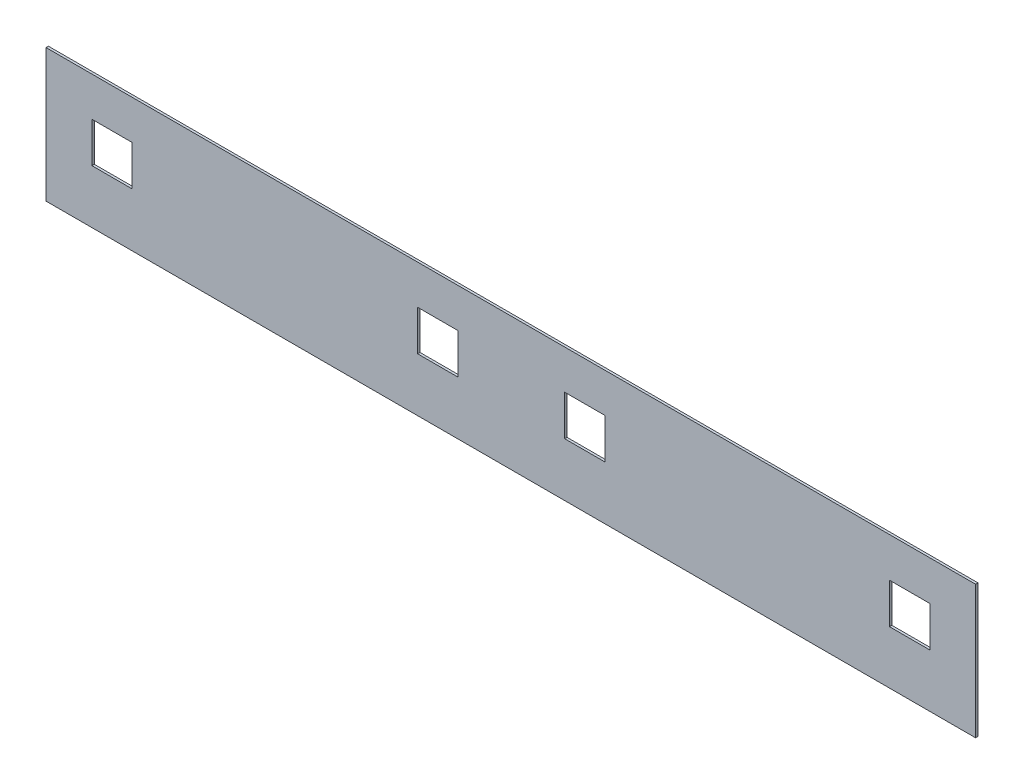
from build123d import *

# Parameters (mm, degrees)
SKETCH2_W          = 621.284
SKETCH2_H          = 88.9
BASE_FLANGE1_DEPTH = 1.5875
SKETCH7_W          = 26.924
SKETCH7_H          = 26.8605
SKETCH7_W_2        = 27.178
SKETCH7_H_2        = 26.8986
SKETCH7_H_3        = 26.924
CUT_EXTRUDE1_DEPTH = 314.81009356


# Sheet-metal steps are written as plain solids
with BuildPart() as part:
    # Sketch2 → Base-Flange1 (new body)
    with BuildSketch(Plane.XY):
        Rectangle(SKETCH2_W, SKETCH2_H)
    extrude(amount=-BASE_FLANGE1_DEPTH)

    # Sketch7 → Cut-Extrude1 (cut, through all)
    with BuildSketch(Plane.XY):
        with Locations((-266.48580561, 4.85775)):
            Rectangle(SKETCH7_W, SKETCH7_H)
        with Locations((266.66976638, 4.5593)):
            Rectangle(SKETCH7_W_2, SKETCH7_H_2)
        with Locations((-48.7934, 4.826)):
            Rectangle(SKETCH7_W, SKETCH7_H_3)
        with Locations((49.5046, 4.826)):
            Rectangle(SKETCH7_W, SKETCH7_H_3)
    extrude(amount=-CUT_EXTRUDE1_DEPTH, mode=Mode.SUBTRACT)


solid = part.part
